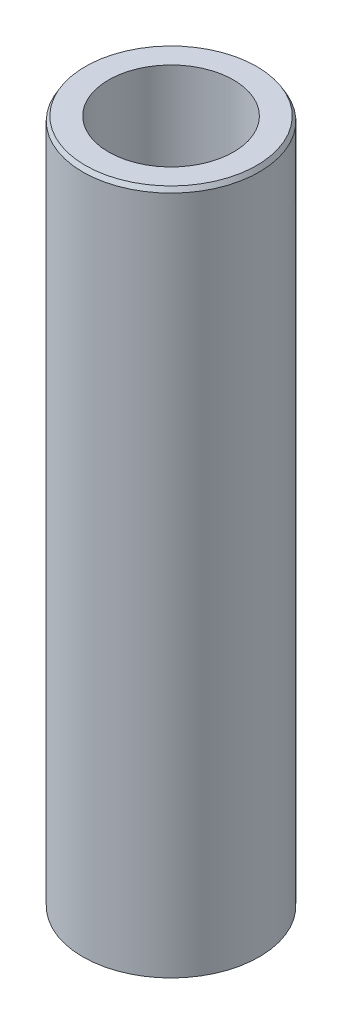
from build123d import *
from OCP.BRepFilletAPI import BRepFilletAPI_MakeChamfer

# Parameters (mm, degrees)
SKETCH1_R           = 25
BOSS_EXTRUDE1_DEPTH = 194.478352323
SKETCH2_R           = 17.698882333
CUT_EXTRUDE1_DEPTH  = 198.665954383
CHAMFER1_SIZE       = 1.248693307
CHAMFER1_SIZE2      = 0.720933417


with BuildPart() as part:
    # Sketch1 → Boss-Extrude1 (new body)
    with BuildSketch(Plane(origin=(0, 0, 0), x_dir=(1, 0, 0), z_dir=(0, 1, 0))):
        Circle(SKETCH1_R)
    extrude(amount=BOSS_EXTRUDE1_DEPTH)

    # Sketch2 → Cut-Extrude1 (cut, through all)
    with BuildSketch(Plane(origin=(0, 0, 0), x_dir=(1, 0, 0), z_dir=(0, 1, 0))):
        Circle(SKETCH2_R)
    extrude(amount=CUT_EXTRUDE1_DEPTH, mode=Mode.SUBTRACT)

    # Chamfer1: one chamfer whose edges measure the first distance from different faces: ONE call of the kernel's chamfer builder (chamfer() names one face for all edges)
    chamfer1_edges_1 = [part.edges().sort_by_distance(p)[0] for p in [
        (-25, 194.478352323, 0),
    ]]
    chamfer1_side_1 = [part.faces().sort_by_distance(p)[0] for p in [
        (-25, 97.239176161, 0),
    ]]
    chamfer1_edges_2 = [part.edges().sort_by_distance(p)[0] for p in [
        (-25, 0, 0),
    ]]
    chamfer1_side_2 = [part.faces().sort_by_distance(p)[0] for p in [
        (-24.292893219, 0, 0),
    ]]
    chamfer1 = BRepFilletAPI_MakeChamfer(part.part.solid().wrapped)
    for e in chamfer1_edges_1:
        chamfer1.Add(CHAMFER1_SIZE, CHAMFER1_SIZE2, e.wrapped, chamfer1_side_1[0].wrapped)  # the first distance lies on this face
    for e in chamfer1_edges_2:
        chamfer1.Add(CHAMFER1_SIZE, CHAMFER1_SIZE2, e.wrapped, chamfer1_side_2[0].wrapped)  # the first distance lies on this face
    add(Compound.cast(chamfer1.Shape()), mode=Mode.REPLACE)


solid = part.part
